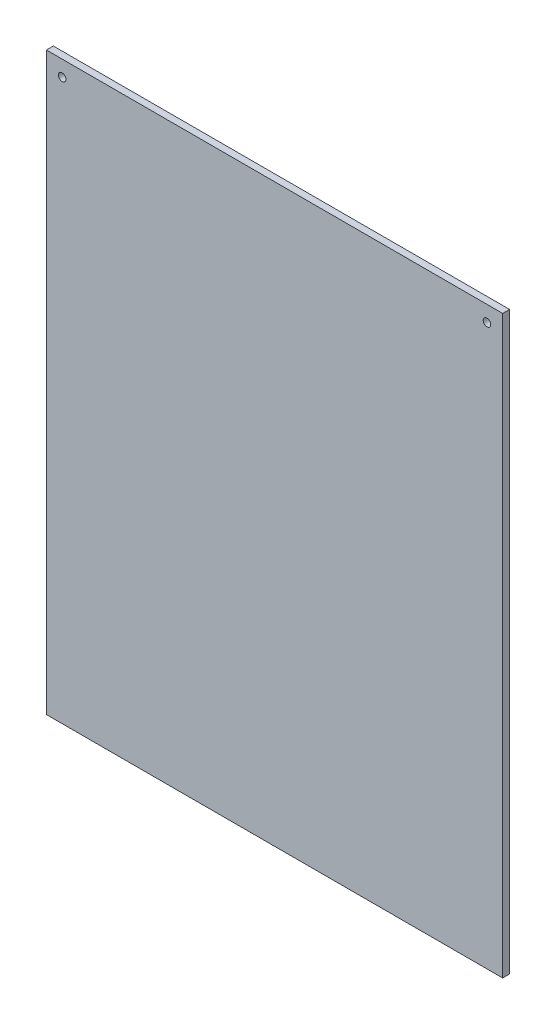
from build123d import *

# Parameters (mm, degrees)
SKETCH1_W           = 218
SKETCH1_H           = 275
SKETCH1_R           = 1.8
BOSS_EXTRUDE1_DEPTH = 3.302


with BuildPart() as part:
    # Sketch1 → Boss-Extrude1 (new body)
    with BuildSketch(Plane.XY):
        with Locations((-27.115183246, 17.382198953)):
            Rectangle(SKETCH1_W, SKETCH1_H)
        with Locations((-128.615183246, 147.382198953)):
            Circle(SKETCH1_R, mode=Mode.SUBTRACT)
        with Locations((74.384816754, 147.382198953)):
            Circle(SKETCH1_R, mode=Mode.SUBTRACT)
    extrude(amount=BOSS_EXTRUDE1_DEPTH)


solid = part.part
